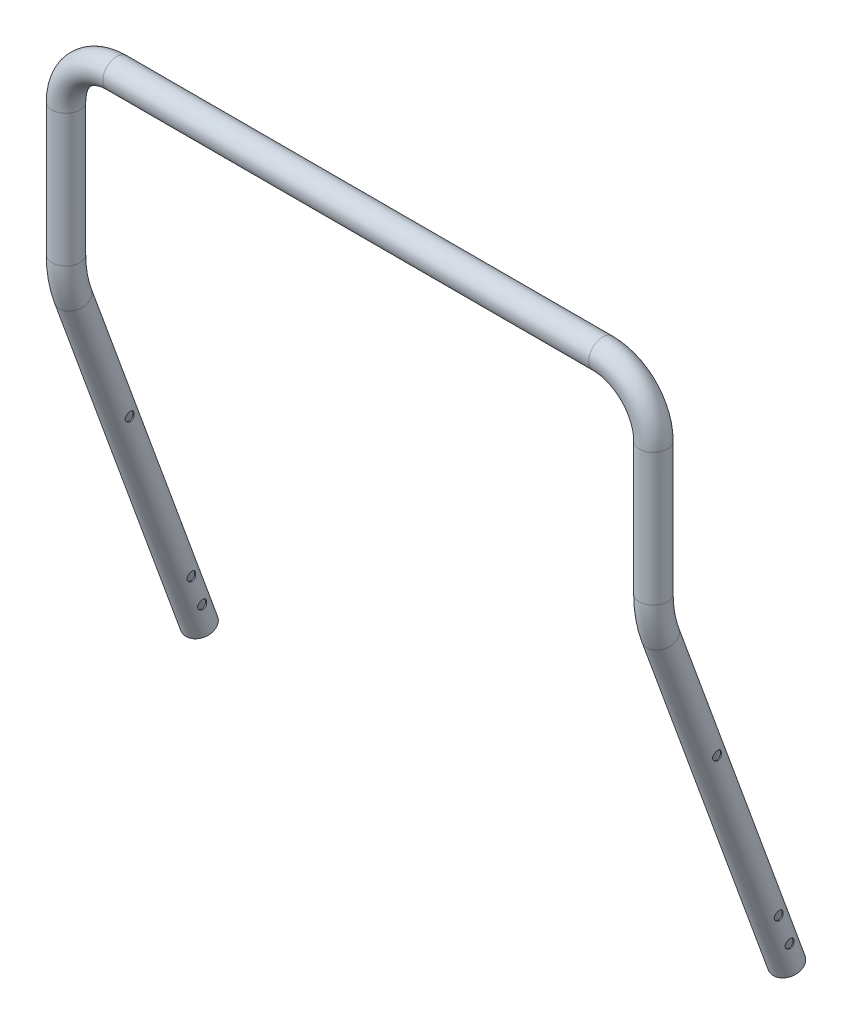
from build123d import *

# Parameters (mm, degrees)
SKETCH9_R                      = 11
SKETCH9_R_2                    = 10.2
SKETCH9_2_R                    = 11
SKETCH9_2_R_2                  = 10.2
CUT_EXTRUDE1_REACH             = 667.233
SKETCH14_R                     = 3.5
CUT_EXTRUDE1_DIRECTION_2_REACH = 667.233


with BuildPart() as part:
    # Sweep2: sweep along a path in Sketch8
    with BuildLine(Plane.XY) as sweep2_path:
        Line((-231.5, -100), (-231.5, -40))
        ThreePointArc((-231.5, -40), (-219.784271247, -11.715728753), (-191.5, 0))
        Line((-191.5, 0), (191.5, 0))
        ThreePointArc((191.5, 0), (219.784271247, -11.715728753), (231.5, -40))
        Line((231.5, -40), (231.5, -100))
    # Sketch9 → Sweep2 (sweep)
    with BuildSketch(Plane(origin=(231.5, -100, 0), x_dir=(-1, 0, 0), z_dir=(0, -1, 0))):
        Circle(SKETCH9_R)
        Circle(SKETCH9_R_2, mode=Mode.SUBTRACT)
    sweep(path=sweep2_path.line)

    # Sweep3: sweep along a path in Sketch13
    with BuildLine(Plane(origin=(231.5, 0, 0), x_dir=(0, 0, -1), z_dir=(1, 0, 0))) as sweep3_path:
        Line((0, -100), (0, -144.259708793))
        ThreePointArc((0, -144.259708793), (1.367302229, -159.888044783), (5.427664129, -175.041521693))
        Line((5.427664129, -175.041521693), (104.967762343, -448.525693866))
    # Sketch9<2> → Sweep3 (sweep)
    with BuildSketch(Plane(origin=(231.5, -100, 0), x_dir=(-1, 0, 0), z_dir=(0, -1, 0))):
        Circle(SKETCH9_2_R)
        Circle(SKETCH9_2_R_2, mode=Mode.SUBTRACT)
    sweep3 = sweep(path=sweep3_path.line)

    # Mirror1: Sweep3 across plane
    add(sweep3.mirror(Plane(origin=(0, 0, 0), x_dir=(0, 0, 1), z_dir=(1, 0, 0))))

    # Sketch14 → Cut-Extrude1 (cut, up to next)
    with BuildSketch(Plane(origin=(231.5, 0, 0), x_dir=(0, 0, -1), z_dir=(1, 0, 0)), mode=Mode.PRIVATE) as cut_extrude1_sk1:
        with Locations((39.659649746, -269.093129199)):
            Circle(SKETCH14_R)
    cut_extrude1_tool1 = extrude(cut_extrude1_sk1.sketch, amount=-CUT_EXTRUDE1_REACH, mode=Mode.PRIVATE) & part.part
    # Sketch14 → Cut-Extrude1 (cut, up to next)
    with BuildSketch(Plane(origin=(231.5, 0, 0), x_dir=(0, 0, -1), z_dir=(1, 0, 0)), mode=Mode.PRIVATE) as cut_extrude1_sk2:
        with Locations((88.226510099, -402.52948135)):
            Circle(SKETCH14_R)
    cut_extrude1_tool2 = extrude(cut_extrude1_sk2.sketch, amount=-CUT_EXTRUDE1_REACH, mode=Mode.PRIVATE) & part.part
    # Sketch14 → Cut-Extrude1 (cut, up to next)
    with BuildSketch(Plane(origin=(231.5, 0, 0), x_dir=(0, 0, -1), z_dir=(1, 0, 0)), mode=Mode.PRIVATE) as cut_extrude1_sk3:
        with Locations((96.777013682, -426.02179687)):
            Circle(SKETCH14_R)
    cut_extrude1_tool3 = extrude(cut_extrude1_sk3.sketch, amount=-CUT_EXTRUDE1_REACH, mode=Mode.PRIVATE) & part.part
    cut_extrude1_1 = cut_extrude1_tool1.solids().sort_by_distance((231.5, -269.093129, -39.65965))[0]
    add(cut_extrude1_1, mode=Mode.SUBTRACT)
    cut_extrude1_2 = cut_extrude1_tool2.solids().sort_by_distance((231.5, -402.529481, -88.22651))[0]
    add(cut_extrude1_2, mode=Mode.SUBTRACT)
    cut_extrude1_3 = cut_extrude1_tool3.solids().sort_by_distance((231.5, -426.021797, -96.777014))[0]
    add(cut_extrude1_3, mode=Mode.SUBTRACT)
    cut_extrude1 = cut_extrude1_1 + cut_extrude1_2 + cut_extrude1_3  # Cut-Extrude1 as one shape, for the pattern or mirror that repeats it

    # Sketch14 → Cut-Extrude1 direction 2 (cut, up to next)
    with BuildSketch(Plane(origin=(231.5, 0, 0), x_dir=(0, 0, -1), z_dir=(1, 0, 0)), mode=Mode.PRIVATE) as cut_extrude1_direction_2_sk1:
        with Locations((39.659649746, -269.093129199)):
            Circle(SKETCH14_R)
    cut_extrude1_direction_2_tool1 = extrude(cut_extrude1_direction_2_sk1.sketch, amount=CUT_EXTRUDE1_DIRECTION_2_REACH, mode=Mode.PRIVATE) & part.part
    # Sketch14 → Cut-Extrude1 direction 2 (cut, up to next)
    with BuildSketch(Plane(origin=(231.5, 0, 0), x_dir=(0, 0, -1), z_dir=(1, 0, 0)), mode=Mode.PRIVATE) as cut_extrude1_direction_2_sk2:
        with Locations((88.226510099, -402.52948135)):
            Circle(SKETCH14_R)
    cut_extrude1_direction_2_tool2 = extrude(cut_extrude1_direction_2_sk2.sketch, amount=CUT_EXTRUDE1_DIRECTION_2_REACH, mode=Mode.PRIVATE) & part.part
    # Sketch14 → Cut-Extrude1 direction 2 (cut, up to next)
    with BuildSketch(Plane(origin=(231.5, 0, 0), x_dir=(0, 0, -1), z_dir=(1, 0, 0)), mode=Mode.PRIVATE) as cut_extrude1_direction_2_sk3:
        with Locations((96.777013682, -426.02179687)):
            Circle(SKETCH14_R)
    cut_extrude1_direction_2_tool3 = extrude(cut_extrude1_direction_2_sk3.sketch, amount=CUT_EXTRUDE1_DIRECTION_2_REACH, mode=Mode.PRIVATE) & part.part
    cut_extrude1_direction_2_1 = cut_extrude1_direction_2_tool1.solids().sort_by_distance((231.5, -269.093129, -39.65965))[0]
    add(cut_extrude1_direction_2_1, mode=Mode.SUBTRACT)
    cut_extrude1_direction_2_2 = cut_extrude1_direction_2_tool2.solids().sort_by_distance((231.5, -402.529481, -88.22651))[0]
    add(cut_extrude1_direction_2_2, mode=Mode.SUBTRACT)
    cut_extrude1_direction_2_3 = cut_extrude1_direction_2_tool3.solids().sort_by_distance((231.5, -426.021797, -96.777014))[0]
    add(cut_extrude1_direction_2_3, mode=Mode.SUBTRACT)
    cut_extrude1_direction_2 = cut_extrude1_direction_2_1 + cut_extrude1_direction_2_2 + cut_extrude1_direction_2_3  # Cut-Extrude1 direction 2 as one shape, for the pattern or mirror that repeats it

    # Mirror2: Cut-Extrude1, Cut-Extrude1 direction 2 across plane
    add(cut_extrude1.mirror(Plane(origin=(0, 0, 0), x_dir=(0, 0, 1), z_dir=(1, 0, 0))), mode=Mode.SUBTRACT)
    add(cut_extrude1_direction_2.mirror(Plane(origin=(0, 0, 0), x_dir=(0, 0, 1), z_dir=(1, 0, 0))), mode=Mode.SUBTRACT)


solid = part.part
